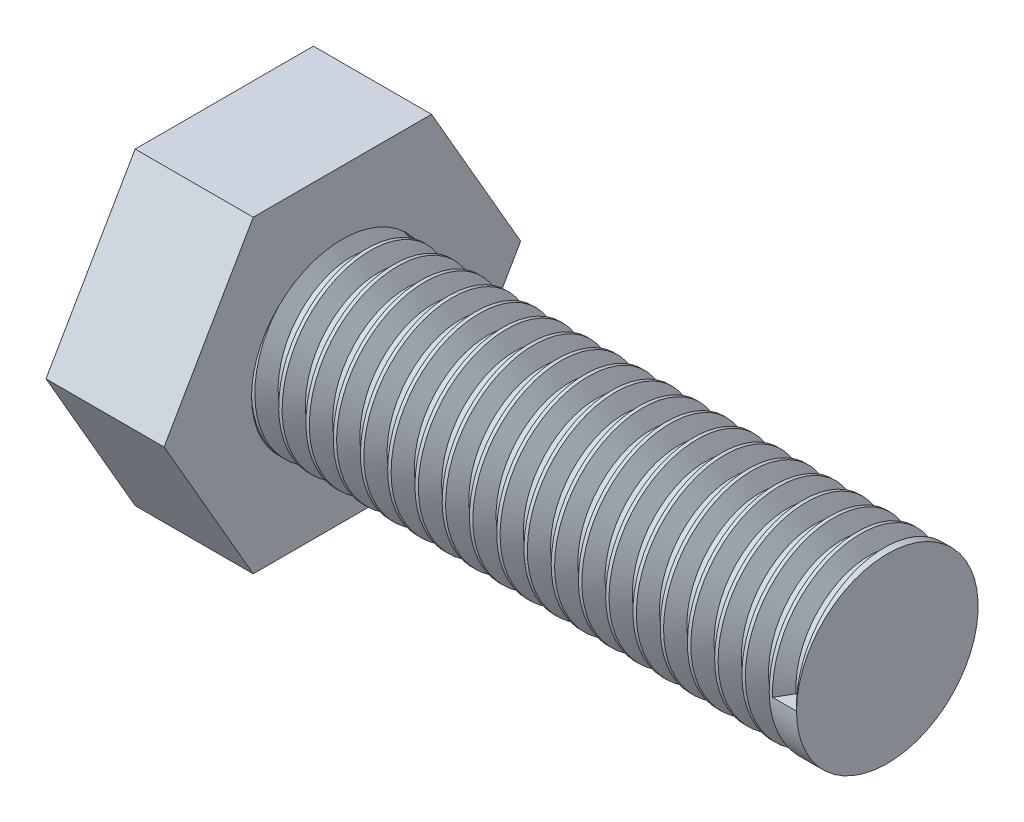
from build123d import *
from build123d.topology import SkipClean

# Parameters (mm, degrees)
SKETCH1_W           = 30
SKETCH1_H           = 5
BOSS_EXTRUDE1_DEPTH = 6.5
THREAD1_PITCH       = 1.5


with BuildPart() as part:
    # Sketch1 → Revolve1 (revolve)
    with BuildSketch(Plane.XY, mode=Mode.PRIVATE) as revolve1_sk:
        with Locations((15, 2.5)):
            Rectangle(SKETCH1_W, SKETCH1_H)
    revolve(revolve1_sk.sketch.rotate(Axis((0, 0, 0), (1, 0, 0)), 180), axis=Axis((0, 0, 0), (1, 0, 0)))

    # Sketch2 → Boss-Extrude1 (add)
    with BuildSketch(Plane.ZY):
        Polygon((9.814954576, 0), (4.907477288, 8.5), (-4.907477288, 8.5), (-9.814954576, 0), (-4.907477288, -8.5), (4.907477288, -8.5), align=None)
    extrude(amount=BOSS_EXTRUDE1_DEPTH)

    # Thread1: the profile of Thread Profile1 profile screwed along a right-hand helix of 20 turns, 8 arcs to a turn; built about Z, then put on its axis
    with SkipClean():  # the faces are left unmerged after this step: merging them gives an invalid solid
        thread1_z = Axis((0, 0, 0), (0, 0, 1))
        thread1_corners = [(5.0003, 0, -0.000173205), (5.0003, 0, 1.312673201), (4.188101188, 0, 0.843749998), (4.188101188, 0, 0.468749998)]
        with BuildLine(mode=Mode.PRIVATE) as thread1_profile:
            Line(thread1_corners[0], thread1_corners[1])
            Line(thread1_corners[1], thread1_corners[2])
            Line(thread1_corners[2], thread1_corners[3])
            Line(thread1_corners[3], thread1_corners[0])
        thread1_cap = Face(thread1_profile.wire())
        thread1_turn_angles = [0, 22.5, 45, 67.5, 90, 112.5, 135, 157.5, 180, 202.5, 225, 247.5, 270, 292.5, 315, 337.5, 360]
        thread1_turn_weights = [1, 0.9238795325112867, 1, 0.9238795325112867, 1, 0.9238795325112867, 1, 0.9238795325112867, 1, 0.9238795325112867, 1, 0.9238795325112867, 1, 0.9238795325112867, 1, 0.9238795325112867, 1]
        thread1_turn_rails = [Edge.make_bspline([Vector(p[0], p[1], 0).rotate(thread1_z, thread1_turn_angles[k]) / thread1_turn_weights[k] + Vector(0, 0, p[2] + THREAD1_PITCH * thread1_turn_angles[k] / 360) for k in range(17)], [0, 0, 0, 1, 1, 2, 2, 3, 3, 4, 4, 5, 5, 6, 6, 7, 7, 8, 8, 8], 2, thread1_turn_weights) for p in thread1_corners]
        thread1_turn_sides = [Face.make_surface_from_curves(thread1_turn_rails[p[0]], thread1_turn_rails[p[1]]) for p in [(0, 1), (1, 2), (2, 3), (3, 0)]]
        thread1 = Plane(origin=(30, 0, 0), x_dir=(0, 0, 1), z_dir=(-1, 0, 0)) * Solid(Shell([*[p.moved(Location((0, 0, THREAD1_PITCH * i))) for i in range(20) for p in thread1_turn_sides], thread1_cap, thread1_cap.rotate(thread1_z, 7200).moved(Location((0, 0, THREAD1_PITCH * 7200 / 360)))]))
        add(thread1, mode=Mode.SUBTRACT)


solid = part.part
